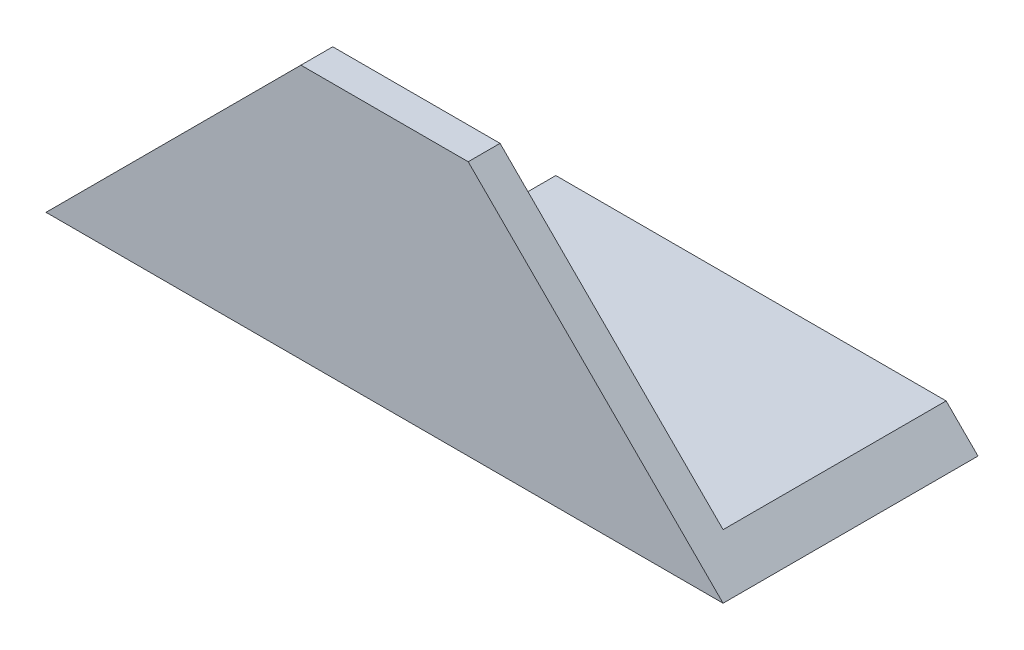
from build123d import *

# Parameters (mm, degrees)
EXTRUDE_1_DEPTH     = 85
CUT_EXTRUDE_1_DEPTH = 97.296417379
SKETCH_3_W          = 32
SKETCH_3_H          = 28
CUT_EXTRUDE_2_DEPTH = 10


with BuildPart() as part:
    # Эскиз1 → Вытянуть-Тонкостенный1 (new body)
    with BuildSketch(Plane(origin=(0, 0, 0), x_dir=(0, 0, -1), z_dir=(1, 0, 0))):
        Polygon((0, 32), (0, 0), (32, 0), (32, 4), (4, 4), (4, 32), align=None)
    extrude(amount=EXTRUDE_1_DEPTH)

    # Эскиз2 → Вырез-Вытянуть1 (cut, through all)
    with BuildSketch(Plane.XY):
        Polygon((0, 0), (0, 32), (32, 32), align=None)
        Polygon((53, 32), (85, 32), (85, 0), align=None)
    extrude(amount=-CUT_EXTRUDE_1_DEPTH, mode=Mode.SUBTRACT)

    # Эскиз3 → Вырез-Вытянуть2 (cut)
    with BuildSketch(Plane.XZ):
        with Locations((16, -18)):
            Rectangle(SKETCH_3_W, SKETCH_3_H)
    extrude(amount=-CUT_EXTRUDE_2_DEPTH, mode=Mode.SUBTRACT)


solid = part.part
